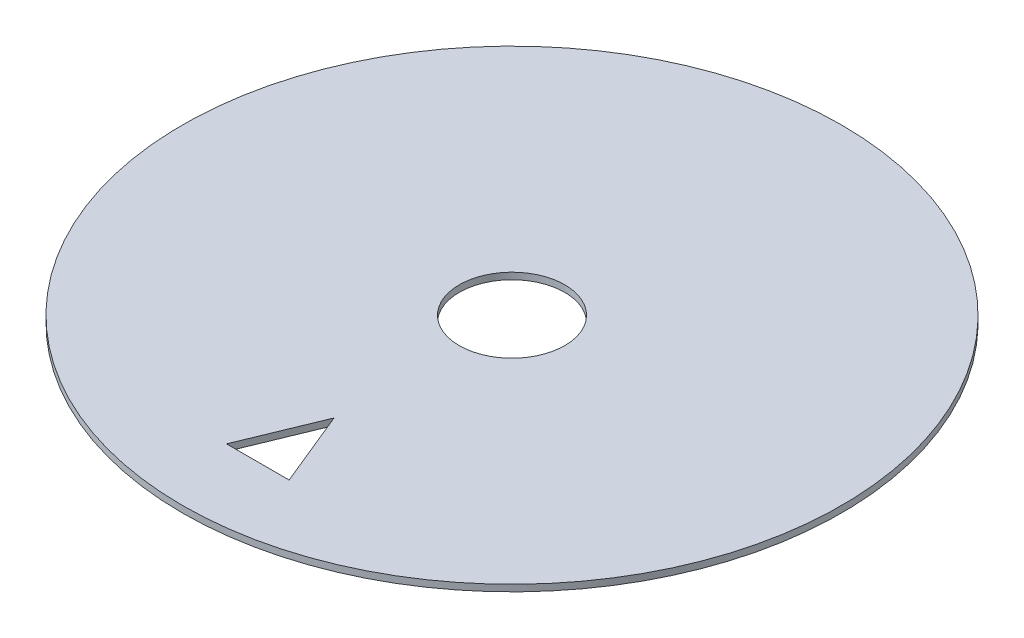
from build123d import *

# Parameters (mm, degrees)
SKETCH1_R           = 100
BOSS_EXTRUDE1_DEPTH = 2
CUT_EXTRUDE1_DEPTH  = 10
CUT_EXTRUDE2_REACH  = 143.435
SKETCH5_R           = 16


with BuildPart() as part:
    # Sketch1 → Boss-Extrude1 (new body)
    with BuildSketch(Plane(origin=(0, 0, 0), x_dir=(1, 0, 0), z_dir=(0, 1, 0))):
        Circle(SKETCH1_R)
    extrude(amount=BOSS_EXTRUDE1_DEPTH)

    # Sketch3 → Cut-Extrude1 (cut)
    with BuildSketch(Plane(origin=(0, 2, 0), x_dir=(1, 0, 0), z_dir=(0, 1, 0))):
        Polygon((-9.5, -77.12466216), (9.5, -77.12466216), (0, -54), align=None)
    extrude(amount=-CUT_EXTRUDE1_DEPTH, mode=Mode.SUBTRACT)

    # Sketch5 → Cut-Extrude2 (cut, up to next)
    with BuildSketch(Plane(origin=(0, 2, 0), x_dir=(1, 0, 0), z_dir=(0, 1, 0)), mode=Mode.PRIVATE) as cut_extrude2_sk1:
        Circle(SKETCH5_R)
    cut_extrude2_tool1 = extrude(cut_extrude2_sk1.sketch, amount=-CUT_EXTRUDE2_REACH, mode=Mode.PRIVATE) & part.part
    add(cut_extrude2_tool1.solids().sort_by_distance((0, 2, 0))[0], mode=Mode.SUBTRACT)


solid = part.part
